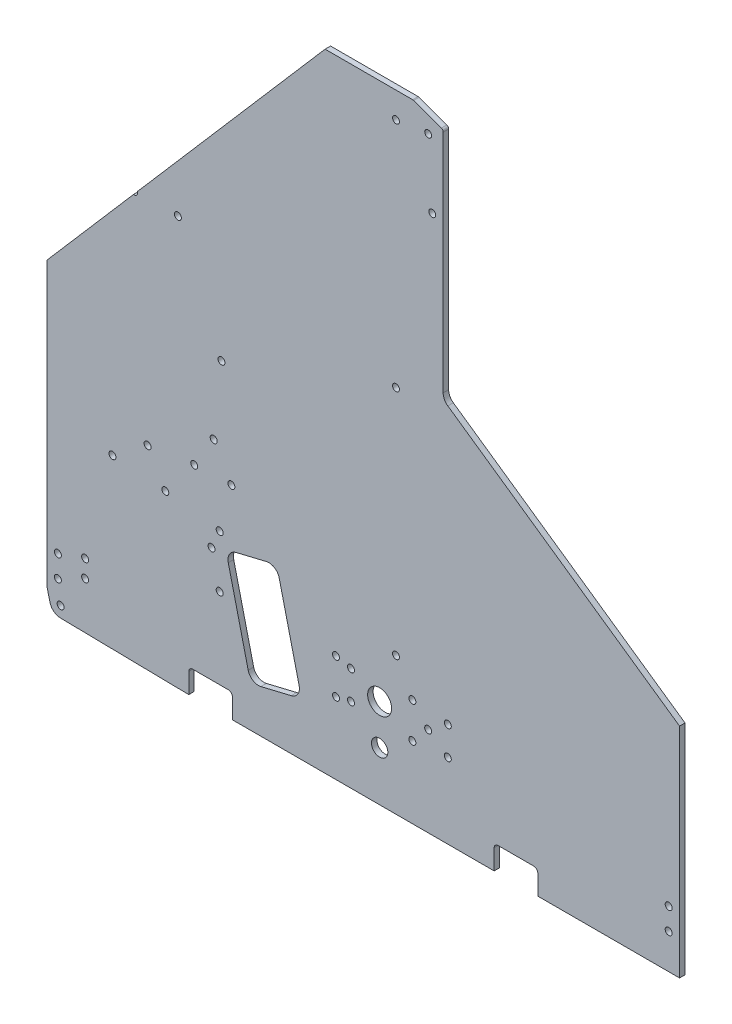
from build123d import *

# Parameters (mm, degrees)
SKETCH1_R           = 2.032
SKETCH1_R_2         = 2
BOSS_EXTRUDE1_DEPTH = 3.175
FILLET1_R           = 2.286
FILLET2_R           = 6.35
SKETCH2_R           = 2.032
CUT_EXTRUDE1_DEPTH  = 505.524983177
FILLET3_R           = 1.5875
CUT_EXTRUDE2_DEPTH  = 505.524983177
SKETCH4_R           = 2.032
SKETCH4_R_2         = 6.985
SKETCH4_R_3         = 4.7625
CUT_EXTRUDE3_DEPTH  = 505.524983177


with BuildPart() as part:
    # Sketch1 → Boss-Extrude1 (new body)
    with BuildSketch(Plane.XY):
        with BuildLine():
            Line((7.829508682, -19.049081656), (82.55, -20.32))
            Line((82.55, -20.32), (82.55, -6.35))
            Line((82.55, -6.35), (107.95, -6.35))
            Line((107.95, -6.35), (107.95, -20.32))
            Line((107.95, -20.32), (260.35, -20.32))
            Line((260.35, -20.32), (260.35, -6.35))
            Line((260.35, -6.35), (285.75, -6.35))
            Line((285.75, -6.35), (285.75, -20.32))
            Line((285.75, -20.32), (368.3, -20.32))
            Line((368.3, -20.32), (368.3, 106.68))
            Line((368.3, 106.68), (230.66375, 202.565))
            Line((230.66375, 202.565), (230.66375, 338.455))
            Line((230.66375, 338.455), (213.19998, 344.805))
            Line((213.19998, 344.805), (203.2, 344.805))
            Line((203.2, 344.805), (161.925, 344.805))
            Line((161.925, 344.805), (52.720122664, 218.469945827))
            ThreePointArc((52.720122664, 218.469945827), (52.803835479, 218.142145922), (52.832, 217.805))
            ThreePointArc((52.832, 217.805), (52.095493096, 216.239521914), (50.419872403, 215.808871996))
            Line((50.419872403, 215.808871996), (0, 157.48))
            Line((0, 157.48), (0, 0))
            Line((0, 0), (0, -6.35))
            ThreePointArc((0, -6.35), (0.047577015, -7.125863724), (0.189595124, -7.890101219))
            Line((0.189595124, -7.890101219), (1.777095124, -14.240101219))
            ThreePointArc((1.777095124, -14.240101219), (3.987212552, -17.671692778), (7.829508682, -19.049081656))
        make_face()
        with Locations((7.9375, -12.7)):
            Circle(SKETCH1_R, mode=Mode.SUBTRACT)
        with Locations((6.35, 0)):
            Circle(SKETCH1_R, mode=Mode.SUBTRACT)
        with Locations((6.35, 12.7)):
            Circle(SKETCH1_R, mode=Mode.SUBTRACT)
        with Locations((95.797306087, 60.410494967)):
            Circle(SKETCH1_R, mode=Mode.SUBTRACT)
        with Locations((38.1, 78.105)):
            Circle(SKETCH1_R, mode=Mode.SUBTRACT)
        with Locations((68.887329744, 75.518700365)):
            Circle(SKETCH1_R, mode=Mode.SUBTRACT)
        with Locations((58.568579744, 93.391299635)):
            Circle(SKETCH1_R, mode=Mode.SUBTRACT)
        with Locations((85.725, 97.155)):
            Circle(SKETCH1_R, mode=Mode.SUBTRACT)
        with Locations((107.382158942, 97.743700365)):
            Circle(SKETCH1_R, mode=Mode.SUBTRACT)
        with Locations((97.063408942, 115.616299635)):
            Circle(SKETCH1_R, mode=Mode.SUBTRACT)
        with Locations((101.6, 157.48)):
            Circle(SKETCH1_R, mode=Mode.SUBTRACT)
        with Locations((203.2, 59.805)):
            Circle(SKETCH1_R_2, mode=Mode.SUBTRACT)
        with Locations((361.95, 0)):
            Circle(SKETCH1_R, mode=Mode.SUBTRACT)
        with Locations((361.95, 12.7)):
            Circle(SKETCH1_R, mode=Mode.SUBTRACT)
        with Locations((76.2, 217.805)):
            Circle(SKETCH1_R, mode=Mode.SUBTRACT)
        with Locations((203.2, 194.805)):
            Circle(SKETCH1_R_2, mode=Mode.SUBTRACT)
        with Locations((224.31375, 293.243)):
            Circle(SKETCH1_R, mode=Mode.SUBTRACT)
        with Locations((203.2, 329.805)):
            Circle(SKETCH1_R_2, mode=Mode.SUBTRACT)
        with Locations((221.931865, 332.105)):
            Circle(SKETCH1_R_2, mode=Mode.SUBTRACT)
    extrude(amount=BOSS_EXTRUDE1_DEPTH)

    # Fillet1
    fillet1_edges = [part.edges().sort_by_distance(p)[0] for p in [
        (285.75, -6.35, 1.5875),
        (107.95, -6.35, 1.5875),
        (260.35, -6.35, 1.5875),
        (82.55, -6.35, 1.5875),
    ]]
    fillet(fillet1_edges, radius=FILLET1_R)

    # Fillet2
    fillet2_edges = [part.edges().sort_by_distance(p)[0] for p in [
        (230.66375, 202.565, 1.5875),
    ]]
    fillet(fillet2_edges, radius=FILLET2_R)

    # Sketch2 → Cut-Extrude1 (cut, through all)
    with BuildSketch(Plane(origin=(0, 0, 0), x_dir=(-1, 0, 0), z_dir=(0, 0, -1))):
        with Locations((-100.552770272, 71.086035298)):
            Circle(SKETCH2_R)
        with Locations((-100.552770272, 40.606035298)):
            Circle(SKETCH2_R)
        with Locations((-22.225, 18.202541089)):
            Circle(SKETCH2_R)
        with Locations((-22.225, 8.042541089)):
            Circle(SKETCH2_R)
    extrude(amount=-CUT_EXTRUDE1_DEPTH, mode=Mode.SUBTRACT)

    # Fillet3
    fillet3_edges = [part.edges().sort_by_distance(p)[0] for p in [
        (230.66375, 338.455, 1.5875),
        (213.19998, 344.805, 1.5875),
    ]]
    fillet(fillet3_edges, radius=FILLET3_R)

    # Sketch3 → Cut-Extrude2 (cut, through all)
    with BuildSketch(Plane.XY.offset(3.175)):
        with BuildLine():
            Line((127.789350211, 69.359774106), (110.090750339, 65.117184968))
            ThreePointArc((110.090750339, 65.117184968), (106.287939856, 62.356288953), (105.55119507, 57.715047577))
            Line((105.55119507, 57.715047577), (117.160037875, 9.287010566))
            ThreePointArc((117.160037875, 9.287010566), (119.92093389, 5.484200083), (124.562175266, 4.747455297))
            Line((124.562175266, 4.747455297), (142.260775137, 8.990044434))
            ThreePointArc((142.260775137, 8.990044434), (146.063585621, 11.75094045), (146.800330407, 16.392181825))
            Line((146.800330407, 16.392181825), (135.191487602, 64.820218836))
            ThreePointArc((135.191487602, 64.820218836), (132.430591586, 68.62302932), (127.789350211, 69.359774106))
        make_face()
    extrude(amount=-CUT_EXTRUDE2_DEPTH, mode=Mode.SUBTRACT)

    # Sketch4 → Cut-Extrude3 (cut, through all)
    with BuildSketch(Plane.XY.offset(3.175)):
        with Locations((168.275, 42.06875)):
            Circle(SKETCH4_R)
        with Locations((212.725, 42.06875)):
            Circle(SKETCH4_R)
        with Locations((212.725, 21.43125)):
            Circle(SKETCH4_R)
        with Locations((168.275, 21.43125)):
            Circle(SKETCH4_R)
        with Locations((193.675, 31.75)):
            Circle(SKETCH4_R_2)
        with Locations((177.00498, 40.0431)):
            Circle(SKETCH4_R)
        with Locations((177.00498, 23.4569)):
            Circle(SKETCH4_R)
        with Locations((193.675, 8.466666658)):
            Circle(SKETCH4_R_3)
        with Locations((221.931865, 31.75)):
            Circle(SKETCH4_R)
        with Locations((233.36123, 23.4569)):
            Circle(SKETCH4_R)
        with Locations((233.36123, 40.0431)):
            Circle(SKETCH4_R)
    extrude(amount=-CUT_EXTRUDE3_DEPTH, mode=Mode.SUBTRACT)


solid = part.part
